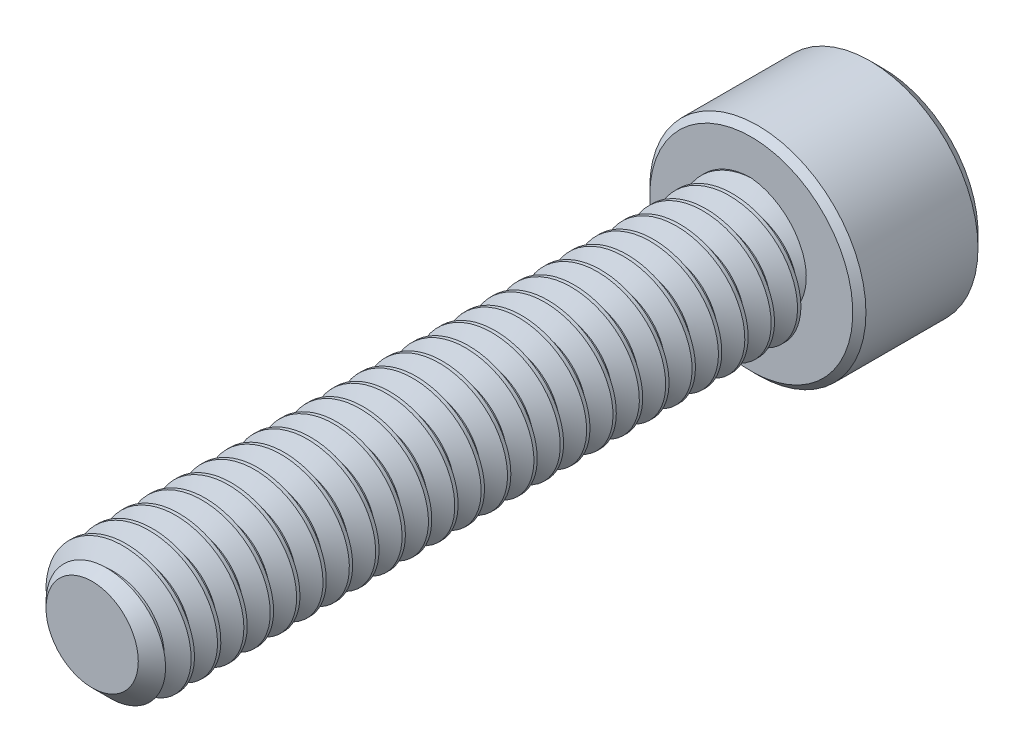
from build123d import *

# Parameters (mm, degrees)
SKETCH1_R          = 1.5875
EXTRUDE1_DEPTH     = 15.875
CHAMFER3_SIZE      = 0.47625
CUT_SWEEP1_PITCH   = 0.635
SKETCH6_R          = 2.6035
EXTRUDE2_DEPTH     = 3.175
CUT_EXTRUDE1_DEPTH = 1.7859375
SKETCH8_R          = 1.374815329
CUT_EXTRUDE2_DEPTH = 0.3175
CUT_EXTRUDE2_DRAFT = -45
CHAMFER1_SIZE      = 0.3175
CHAMFER2_SIZE      = 0.15875


with BuildPart() as part:
    # Sketch1 → Extrude1 (new body)
    with BuildSketch(Plane.XY):
        Circle(SKETCH1_R)
    extrude(amount=-EXTRUDE1_DEPTH)

    # Chamfer3
    chamfer3_edges = [part.edges().sort_by_distance(p)[0] for p in [
        (-1.5875, 0, 0),
    ]]
    chamfer(chamfer3_edges, length=CHAMFER3_SIZE)

    # Cut-Sweep1: arcs per turn and ends read off the stored shape
    # Cut-Sweep1: the profile of Sketch3 profile screwed along a right-hand helix through 27 turns, 6 arcs to a turn; built about Z, then put on its axis
    cut_sweep1_z = Axis((0, 0, 0), (0, 0, 1))
    cut_sweep1_corners = [(1.5878, 0, -0.555798205), (1.175055401, 0, -0.3175), (1.175055401, 0, -0.238125), (1.5878, 0, 0.000173205)]
    with BuildLine(mode=Mode.PRIVATE) as cut_sweep1_profile:
        Line(cut_sweep1_corners[0], cut_sweep1_corners[1])
        Line(cut_sweep1_corners[1], cut_sweep1_corners[2])
        Line(cut_sweep1_corners[2], cut_sweep1_corners[3])
        Line(cut_sweep1_corners[3], cut_sweep1_corners[0])
    cut_sweep1_cap = Face(cut_sweep1_profile.wire())
    cut_sweep1_turn_angles = [0, 30, 60, 90, 120, 150, 180, 210, 240, 270, 300, 330, 360]
    cut_sweep1_turn_weights = [1, 0.8660254037844387, 1, 0.8660254037844387, 1, 0.8660254037844387, 1, 0.8660254037844387, 1, 0.8660254037844387, 1, 0.8660254037844387, 1]
    cut_sweep1_turn_rails = [Edge.make_bspline([Vector(p[0], p[1], 0).rotate(cut_sweep1_z, cut_sweep1_turn_angles[k]) / cut_sweep1_turn_weights[k] + Vector(0, 0, p[2] + CUT_SWEEP1_PITCH * cut_sweep1_turn_angles[k] / 360) for k in range(13)], [0, 0, 0, 1, 1, 2, 2, 3, 3, 4, 4, 5, 5, 6, 6, 6], 2, cut_sweep1_turn_weights) for p in cut_sweep1_corners]
    cut_sweep1_turn_sides = [Face.make_surface_from_curves(cut_sweep1_turn_rails[p[0]], cut_sweep1_turn_rails[p[1]]) for p in [(0, 1), (1, 2), (2, 3), (3, 0)]]
    cut_sweep1 = Plane(origin=(0, 0, 0), x_dir=(0, 1, 0), z_dir=(0, 0, -1)) * Solid(Shell([*[p.moved(Location((0, 0, CUT_SWEEP1_PITCH * i))) for i in range(27) for p in cut_sweep1_turn_sides], cut_sweep1_cap, cut_sweep1_cap.rotate(cut_sweep1_z, 9720).moved(Location((0, 0, CUT_SWEEP1_PITCH * 9720 / 360)))]))
    add(cut_sweep1, mode=Mode.SUBTRACT)

    # Sketch6 → Extrude2 (add)
    with BuildSketch(Plane(origin=(0, 0, -15.875), x_dir=(-1, 0, 0), z_dir=(0, 0, -1))):
        Circle(SKETCH6_R)
    extrude(amount=EXTRUDE2_DEPTH)

    # Sketch7 → Cut-Extrude1 (cut)
    with BuildSketch(Plane(origin=(0, 0, -19.05), x_dir=(-1, 0, 0), z_dir=(0, 0, -1))):
        Polygon((0, 1.374815329), (-1.190625, 0.687407664), (-1.190625, -0.687407664), (0, -1.374815329), (1.190625, -0.687407664), (1.190625, 0.687407664), align=None)
    extrude(amount=-CUT_EXTRUDE1_DEPTH, mode=Mode.SUBTRACT)


with BuildPart() as cut_extrude2_tool:
    # Sketch8 → Cut-Extrude2 (with draft: the straight prism first)
    with BuildSketch(Plane(origin=(0, 0, -19.05), x_dir=(-1, 0, 0), z_dir=(0, 0, -1))):
        Circle(SKETCH8_R)
    extrude(amount=-CUT_EXTRUDE2_DEPTH)
    # Cut-Extrude2: the draft: its side faces are tilted about the plane it starts from
    cut_extrude2_sides = [cut_extrude2_tool.faces().sort_by_distance(p)[0] for p in [
        (1.374815329, 0, -18.89125),
    ]]
    draft(cut_extrude2_sides, Plane(origin=(0, 0, -19.05), x_dir=(-1, 0, 0), z_dir=(0, 0, -1)), CUT_EXTRUDE2_DRAFT)


with BuildPart() as part_1:
    add(part.part)

    # Cut-Extrude2: cut by cut_extrude2_tool
    add(cut_extrude2_tool.part, mode=Mode.SUBTRACT)

    # Chamfer1
    chamfer1_edges = [part_1.edges().sort_by_distance(p)[0] for p in [
        (2.6035, 0, -19.05),
    ]]
    chamfer(chamfer1_edges, length=CHAMFER1_SIZE)

    # Chamfer2
    chamfer2_edges = [part_1.edges().sort_by_distance(p)[0] for p in [
        (2.6035, 0, -15.875),
    ]]
    chamfer(chamfer2_edges, length=CHAMFER2_SIZE)


solid = part_1.part
